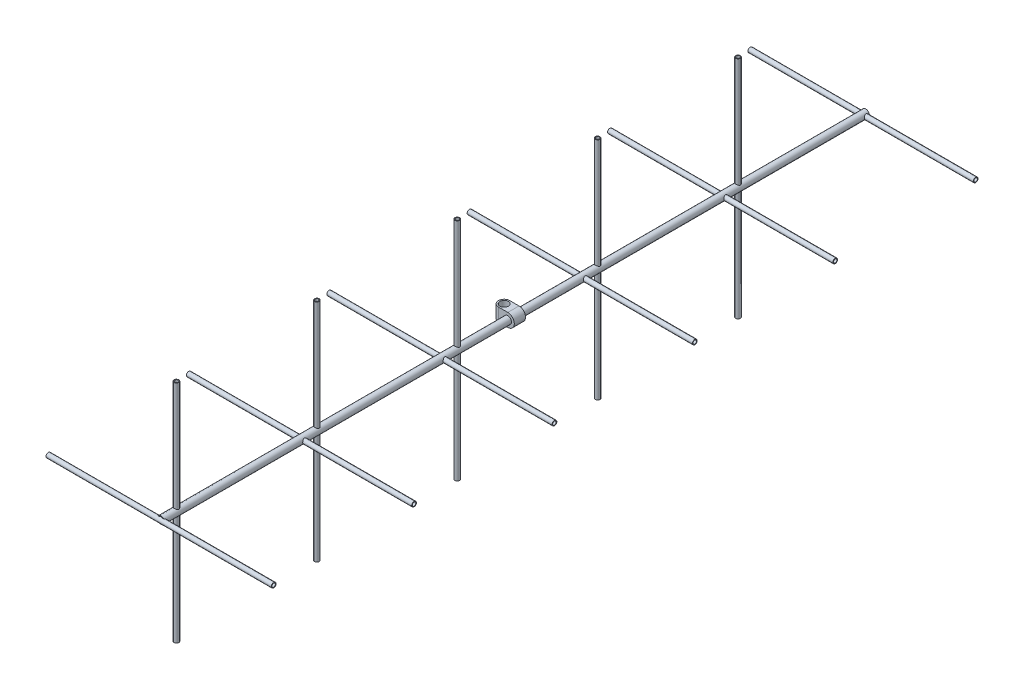
from build123d import *

# Parameters (mm, degrees)
SKETCH11_R                 = 16.7005
SKETCH11_R_2               = 13.3223
PIPE_1_0_SCH_40_1_DEPTH    = 3187.7
SKETCH12_R                 = 10.668
SKETCH12_R_2               = 7.8994
PIPE_0_5_SCH_40_1_DEPTH    = 1019.175
SKETCH12_ON_SEGMENT_2_R    = 10.668
SKETCH12_ON_SEGMENT_2_R_2  = 7.8994
PIPE_0_5_SCH_40_1_2_DEPTH  = 1019.175
SKETCH12_ON_SEGMENT_3_R    = 10.668
SKETCH12_ON_SEGMENT_3_R_2  = 7.8994
PIPE_0_5_SCH_40_1_3_DEPTH  = 1019.175
SKETCH12_ON_SEGMENT_4_R    = 10.668
SKETCH12_ON_SEGMENT_4_R_2  = 7.8994
PIPE_0_5_SCH_40_1_4_DEPTH  = 1019.175
SKETCH12_ON_SEGMENT_5_R    = 10.668
SKETCH12_ON_SEGMENT_5_R_2  = 7.8994
PIPE_0_5_SCH_40_1_5_DEPTH  = 1019.175
SKETCH12_ON_SEGMENT_6_R    = 10.668
SKETCH12_ON_SEGMENT_6_R_2  = 7.8994
PIPE_0_5_SCH_40_1_6_DEPTH  = 1019.175
SKETCH12_ON_SEGMENT_7_R    = 10.668
SKETCH12_ON_SEGMENT_7_R_2  = 7.8994
PIPE_0_5_SCH_40_1_7_DEPTH  = 1019.175
SKETCH12_ON_SEGMENT_8_R    = 10.668
SKETCH12_ON_SEGMENT_8_R_2  = 7.8994
PIPE_0_5_SCH_40_1_8_DEPTH  = 1019.175
SKETCH12_ON_SEGMENT_9_R    = 10.668
SKETCH12_ON_SEGMENT_9_R_2  = 7.8994
PIPE_0_5_SCH_40_1_9_DEPTH  = 1019.175
SKETCH12_ON_SEGMENT_10_R   = 10.668
SKETCH12_ON_SEGMENT_10_R_2 = 7.8994
PIPE_0_5_SCH_40_1_10_DEPTH = 1019.175
SKETCH12_ON_SEGMENT_11_R   = 10.668
SKETCH12_ON_SEGMENT_11_R_2 = 7.8994
PIPE_0_5_SCH_40_1_11_DEPTH = 1019.175
SKETCH14_R                 = 16.7005
BOSS_EXTRUDE1_DEPTH        = 25.4
FILLET1_R                  = 25.4
SKETCH15_R                 = 19.05
CUT_EXTRUDE1_DEPTH         = 1768.672338592


with BuildPart() as part:
    # Sketch11 → Pipe 1.0 SCH 40(1) (new body)
    with BuildSketch(Plane(origin=(0, 0, 1593.85), x_dir=(-1, 0, 0), z_dir=(0, 0, -1))):
        Circle(SKETCH11_R)
        Circle(SKETCH11_R_2, mode=Mode.SUBTRACT)
    extrude(amount=PIPE_1_0_SCH_40_1_DEPTH)


with BuildPart() as body_2:
    # Sketch12 → Pipe 0.5 SCH 40(1) (new body)
    with BuildSketch(Plane(origin=(-509.5875, 0, 1593.85), x_dir=(0, 0, -1), z_dir=(1, 0, 0))):
        Circle(SKETCH12_R)
        Circle(SKETCH12_R_2, mode=Mode.SUBTRACT)
    extrude(amount=PIPE_0_5_SCH_40_1_DEPTH)


with BuildPart() as body_3:
    # Sketch12 on segment 2 (carried to segment 2) → Pipe 0.5 SCH 40_1 2 (new body)
    with BuildSketch(Plane(origin=(0, -509.5875, 1524), x_dir=(0, 0, -1), z_dir=(0, 1, 0))):
        Circle(SKETCH12_ON_SEGMENT_2_R)
        Circle(SKETCH12_ON_SEGMENT_2_R_2, mode=Mode.SUBTRACT)
    extrude(amount=PIPE_0_5_SCH_40_1_2_DEPTH)


with BuildPart() as body_4:
    # Sketch12 on segment 3 (carried to segment 3) → Pipe 0.5 SCH 40_1 3 (new body)
    with BuildSketch(Plane(origin=(-509.5875, 0, 958.85), x_dir=(0, 0, -1), z_dir=(1, 0, 0))):
        Circle(SKETCH12_ON_SEGMENT_3_R)
        Circle(SKETCH12_ON_SEGMENT_3_R_2, mode=Mode.SUBTRACT)
    extrude(amount=PIPE_0_5_SCH_40_1_3_DEPTH)


with BuildPart() as body_5:
    # Sketch12 on segment 4 (carried to segment 4) → Pipe 0.5 SCH 40_1 4 (new body)
    with BuildSketch(Plane(origin=(0, -509.5875, 889), x_dir=(0, 0, -1), z_dir=(0, 1, 0))):
        Circle(SKETCH12_ON_SEGMENT_4_R)
        Circle(SKETCH12_ON_SEGMENT_4_R_2, mode=Mode.SUBTRACT)
    extrude(amount=PIPE_0_5_SCH_40_1_4_DEPTH)


with BuildPart() as body_6:
    # Sketch12 on segment 5 (carried to segment 5) → Pipe 0.5 SCH 40_1 5 (new body)
    with BuildSketch(Plane(origin=(0, -509.5875, 254), x_dir=(0, 0, -1), z_dir=(0, 1, 0))):
        Circle(SKETCH12_ON_SEGMENT_5_R)
        Circle(SKETCH12_ON_SEGMENT_5_R_2, mode=Mode.SUBTRACT)
    extrude(amount=PIPE_0_5_SCH_40_1_5_DEPTH)


with BuildPart() as body_7:
    # Sketch12 on segment 6 (carried to segment 6) → Pipe 0.5 SCH 40_1 6 (new body)
    with BuildSketch(Plane(origin=(-509.5875, 0, 323.85), x_dir=(0, 0, -1), z_dir=(1, 0, 0))):
        Circle(SKETCH12_ON_SEGMENT_6_R)
        Circle(SKETCH12_ON_SEGMENT_6_R_2, mode=Mode.SUBTRACT)
    extrude(amount=PIPE_0_5_SCH_40_1_6_DEPTH)


with BuildPart() as body_8:
    # Sketch12 on segment 7 (carried to segment 7) → Pipe 0.5 SCH 40_1 7 (new body)
    with BuildSketch(Plane(origin=(-509.5875, 0, -311.15), x_dir=(0, 0, -1), z_dir=(1, 0, 0))):
        Circle(SKETCH12_ON_SEGMENT_7_R)
        Circle(SKETCH12_ON_SEGMENT_7_R_2, mode=Mode.SUBTRACT)
    extrude(amount=PIPE_0_5_SCH_40_1_7_DEPTH)


with BuildPart() as body_9:
    # Sketch12 on segment 8 (carried to segment 8) → Pipe 0.5 SCH 40_1 8 (new body)
    with BuildSketch(Plane(origin=(0, -509.5875, -381), x_dir=(0, 0, -1), z_dir=(0, 1, 0))):
        Circle(SKETCH12_ON_SEGMENT_8_R)
        Circle(SKETCH12_ON_SEGMENT_8_R_2, mode=Mode.SUBTRACT)
    extrude(amount=PIPE_0_5_SCH_40_1_8_DEPTH)


with BuildPart() as body_10:
    # Sketch12 on segment 9 (carried to segment 9) → Pipe 0.5 SCH 40_1 9 (new body)
    with BuildSketch(Plane(origin=(0, -509.5875, -1016), x_dir=(0, 0, -1), z_dir=(0, 1, 0))):
        Circle(SKETCH12_ON_SEGMENT_9_R)
        Circle(SKETCH12_ON_SEGMENT_9_R_2, mode=Mode.SUBTRACT)
    extrude(amount=PIPE_0_5_SCH_40_1_9_DEPTH)


with BuildPart() as body_11:
    # Sketch12 on segment 10 (carried to segment 10) → Pipe 0.5 SCH 40_1 10 (new body)
    with BuildSketch(Plane(origin=(-509.5875, 0, -946.15), x_dir=(0, 0, -1), z_dir=(1, 0, 0))):
        Circle(SKETCH12_ON_SEGMENT_10_R)
        Circle(SKETCH12_ON_SEGMENT_10_R_2, mode=Mode.SUBTRACT)
    extrude(amount=PIPE_0_5_SCH_40_1_10_DEPTH)


with BuildPart() as body_12:
    # Sketch12 on segment 11 (carried to segment 11) → Pipe 0.5 SCH 40_1 11 (new body)
    with BuildSketch(Plane(origin=(-509.5875, 0, -1581.15), x_dir=(0, 0, -1), z_dir=(1, 0, 0))):
        Circle(SKETCH12_ON_SEGMENT_11_R)
        Circle(SKETCH12_ON_SEGMENT_11_R_2, mode=Mode.SUBTRACT)
    extrude(amount=PIPE_0_5_SCH_40_1_11_DEPTH)


with BuildPart() as body_13:
    # Sketch14 → Boss-Extrude1 (new, symmetric)
    with BuildSketch(Plane.XY):
        with BuildLine():
            Line((-67.5005, -29.4005), (-67.5005, 29.4005))
            Line((-67.5005, 29.4005), (0, 29.4005))
            ThreePointArc((0, 29.4005), (29.4005, 0), (0, -29.4005))
            Line((0, -29.4005), (-67.5005, -29.4005))
        make_face()
        Circle(SKETCH14_R, mode=Mode.SUBTRACT)
    extrude(amount=BOSS_EXTRUDE1_DEPTH, both=True)

    # Fillet1
    fillet1_edges = [body_13.edges().sort_by_distance(p)[0] for p in [
        (-67.5005, 0, -25.4),
        (-67.5005, 0, 25.4),
    ]]
    fillet(fillet1_edges, radius=FILLET1_R - 0.0001)  # a hair under: the kernel refuses the full size

    # Sketch15 → Cut-Extrude1 (cut, through all)
    with BuildSketch(Plane(origin=(0, 29.4005, 0), x_dir=(1, 0, 0), z_dir=(0, 1, 0))):
        with Locations(Location((-42.1005, 0, 0), (0, 0, 270))):
            Circle(SKETCH15_R)
    extrude(amount=-CUT_EXTRUDE1_DEPTH, mode=Mode.SUBTRACT)


solid = Compound([part.part, body_2.part, body_3.part, body_4.part, body_5.part, body_6.part, body_7.part, body_8.part, body_9.part, body_10.part, body_11.part, body_12.part, body_13.part])
